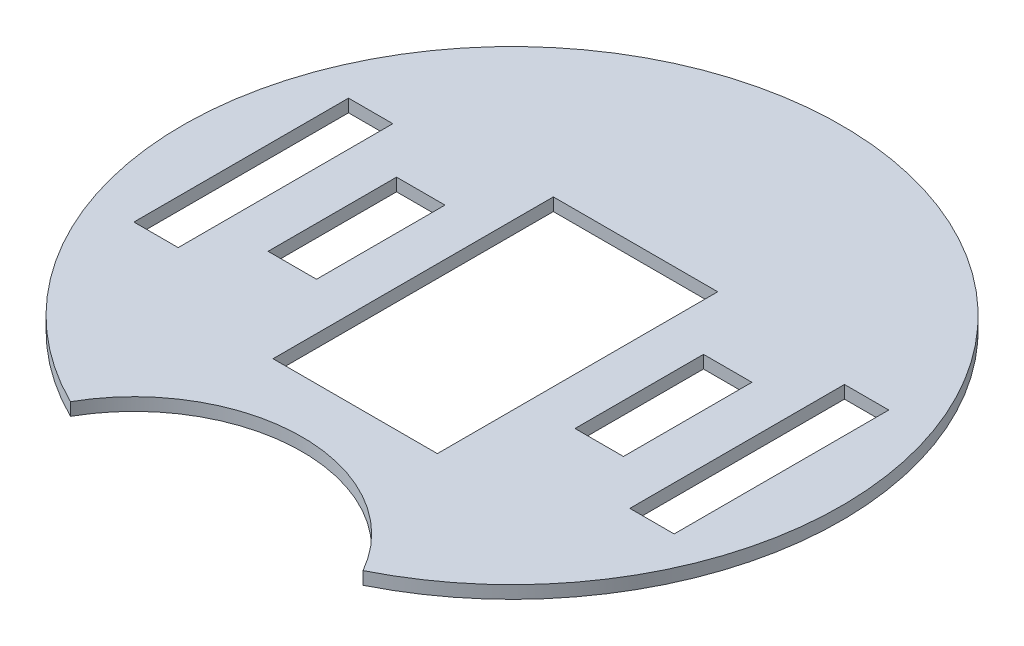
from build123d import *

# Parameters (mm, degrees)
BOSS_EXTRUDE1_DEPTH  = 2.9
SOLENOID_PLACEMENT_W = 37.4
SOLENOID_PLACEMENT_H = 63.8
CUT_EXTRUDE1_DEPTH   = 107.105654892
SKETCH2_W            = 10.078703816
SKETCH2_H            = 48.844433865
CUT_EXTRUDE2_DEPTH   = 107.105654892
SKETCH3_W            = 11.023122164
SKETCH3_H            = 29.238616442
CUT_EXTRUDE3_DEPTH   = 107.105654892


with BuildPart() as part:
    # Sketch1 → Boss-Extrude1 (new body)
    with BuildSketch(Plane(origin=(0, 0, 0), x_dir=(1, 0, 0), z_dir=(0, 1, 0))):
        with BuildLine():
            ThreePointArc((33.29110537, -67.206415641), (0, 75), (-33.29110537, -67.206415641))
            ThreePointArc((-33.29110537, -67.206415641), (0, -47.791616815), (33.29110537, -67.206415641))
        make_face()
    extrude(amount=BOSS_EXTRUDE1_DEPTH)

    # solenoid placement → Cut-Extrude1 (cut, through all)
    with BuildSketch(Plane(origin=(0, 2.9, 0), x_dir=(1, 0, 0), z_dir=(0, 1, 0))):
        with Locations((0, -3.8)):
            Rectangle(SOLENOID_PLACEMENT_W, SOLENOID_PLACEMENT_H)
    extrude(amount=-CUT_EXTRUDE1_DEPTH, mode=Mode.SUBTRACT)

    # Sketch2 → Cut-Extrude2 (cut, through all)
    with BuildSketch(Plane(origin=(0, 2.9, 0), x_dir=(1, 0, 0), z_dir=(0, 1, 0))):
        with Locations((56.433097695, -0.165843752)):
            Rectangle(SKETCH2_W, SKETCH2_H)
        with Locations((-56.433097695, -0.165843752)):
            Rectangle(SKETCH2_W, SKETCH2_H)
    extrude(amount=-CUT_EXTRUDE2_DEPTH, mode=Mode.SUBTRACT)

    # Sketch3 → Cut-Extrude3 (cut, through all)
    with BuildSketch(Plane(origin=(0, 2.9, 0), x_dir=(1, 0, 0), z_dir=(0, 1, 0))):
        with Locations((-34.92524858, -0.47002534)):
            Rectangle(SKETCH3_W, SKETCH3_H)
        with Locations((34.92524858, -0.47002534)):
            Rectangle(SKETCH3_W, SKETCH3_H)
    extrude(amount=-CUT_EXTRUDE3_DEPTH, mode=Mode.SUBTRACT)


solid = part.part
